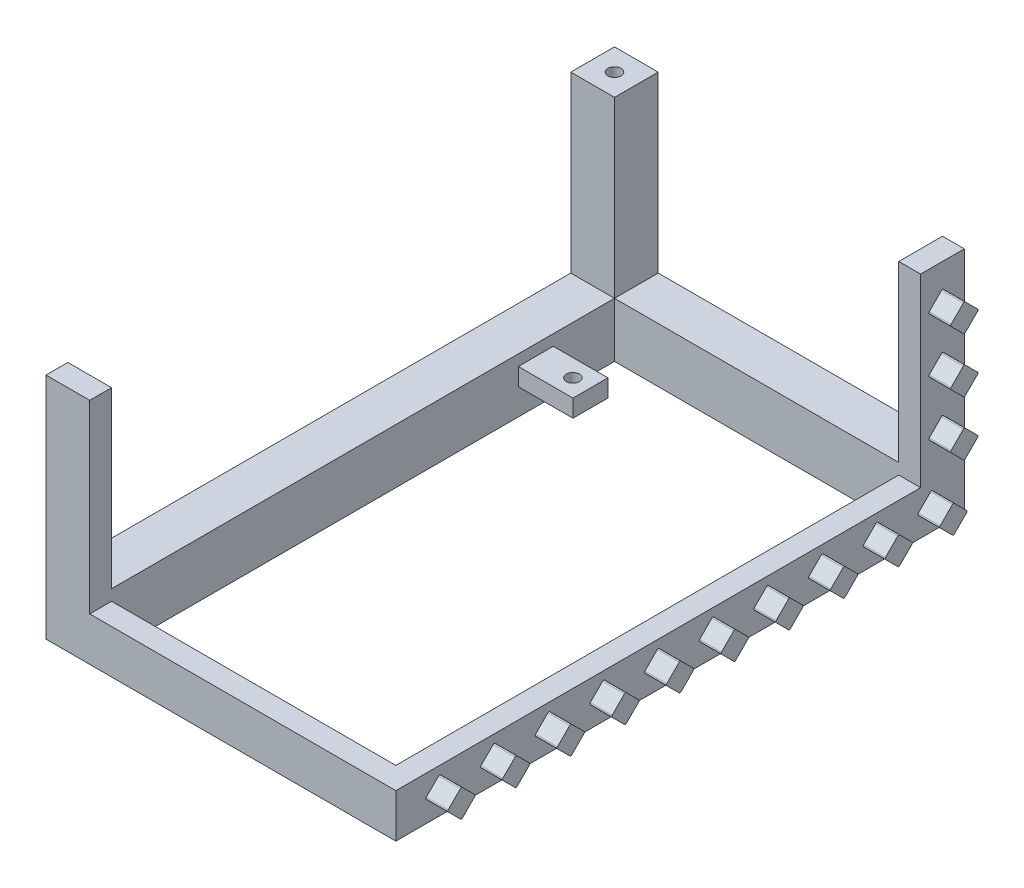
from build123d import *

# Parameters (mm, degrees)
SKETCH1_W            = 80
SKETCH1_H            = 130
BOSS_EXTRUDE1_DEPTH  = 10
BOSS_EXTRUDE10_DEPTH = 42.3
SKETCH13_W           = 115
SKETCH13_H           = 39.8
CUT_EXTRUDE3_DEPTH   = 112.961109319
SKETCH14_W           = 65
SKETCH14_H           = 39.8
CUT_EXTRUDE4_DEPTH   = 139.420699319
SKETCH15_R           = 1.5
CUT_EXTRUDE5_DEPTH   = 4
SKETCH21_R           = 1.5
CUT_EXTRUDE8_DEPTH   = 94.350361542
BOSS_EXTRUDE11_DEPTH = 5
CUT_EXTRUDE9_DEPTH   = 94.350361542
CUT_EXTRUDE10_START  = -4
SKETCH24_R           = 1.5
CUT_EXTRUDE10_DEPTH  = 4
SKETCH25_W           = 12.5
SKETCH25_H           = 8
CUT_EXTRUDE11_DEPTH  = 6


with BuildPart() as part:
    # Sketch1 → Boss-Extrude1 (new body)
    with BuildSketch(Plane(origin=(0, 0, 0), x_dir=(1, 0, 0), z_dir=(0, 1, 0))):
        with Locations((-5, 5)):
            Rectangle(SKETCH1_W, SKETCH1_H)
    extrude(amount=BOSS_EXTRUDE1_DEPTH)

    # Sketch9 → Boss-Extrude10 (add)
    with BuildSketch(Plane(origin=(0, 10, 0), x_dir=(1, 0, 0), z_dir=(0, 1, 0))):
        Polygon((35, 70), (-45, 70), (-45, -60), (-35, -60), (-35, 60), (35, 60), align=None)
    extrude(amount=BOSS_EXTRUDE10_DEPTH)

    # Sketch13 → Cut-Extrude3 (cut, through all)
    with BuildSketch(Plane(origin=(-35, 0, 0), x_dir=(0, 0, -1), z_dir=(1, 0, 0))):
        with Locations((2.5, 32.4)):
            Rectangle(SKETCH13_W, SKETCH13_H)
    extrude(amount=-CUT_EXTRUDE3_DEPTH, mode=Mode.SUBTRACT)

    # Sketch14 → Cut-Extrude4 (cut, through all)
    with BuildSketch(Plane.XY.offset(-60)):
        with Locations((-2.5, 32.4)):
            Rectangle(SKETCH14_W, SKETCH14_H)
    extrude(amount=-CUT_EXTRUDE4_DEPTH, mode=Mode.SUBTRACT)

    # Sketch15 → Cut-Extrude5 (cut)
    with BuildSketch(Plane(origin=(0, 52.3, 0), x_dir=(1, 0, 0), z_dir=(0, 1, 0))):
        with Locations((-40, 65)):
            Circle(SKETCH15_R)
    extrude(amount=-CUT_EXTRUDE5_DEPTH, mode=Mode.SUBTRACT)

    # Sketch21 → Cut-Extrude8 (cut, through all)
    with BuildSketch(Plane(origin=(0, 10, 0), x_dir=(1, 0, 0), z_dir=(0, 1, 0))):
        with Locations((-26.5, 42)):
            Circle(SKETCH21_R)
    extrude(amount=-CUT_EXTRUDE8_DEPTH, mode=Mode.SUBTRACT)

    # Sketch22 → Boss-Extrude11 (add)
    with BuildSketch(Plane(origin=(35, 0, 0), x_dir=(0, 0, -1), z_dir=(1, 0, 0))):
        with BuildLine():
            Line((-0.212132034, 8.037867966), (-3.037867966, 5.212132034))
            ThreePointArc((-3.037867966, 5.212132034), (-3.125735931, 5), (-3.037867966, 4.787867966))
            Line((-3.037867966, 4.787867966), (-0.212132034, 1.962132034))
            ThreePointArc((-0.212132034, 1.962132034), (0, 1.874264069), (0.212132034, 1.962132034))
            Line((0.212132034, 1.962132034), (3.037867966, 4.787867966))
            ThreePointArc((3.037867966, 4.787867966), (3.125735931, 5), (3.037867966, 5.212132034))
            Line((3.037867966, 5.212132034), (0.212132034, 8.037867966))
            ThreePointArc((0.212132034, 8.037867966), (0, 8.125735931), (-0.212132034, 8.037867966))
        make_face()
        with BuildLine():
            Line((15.537867966, 5.212132034), (12.712132034, 8.037867966))
            ThreePointArc((12.712132034, 8.037867966), (12.5, 8.125735931), (12.287867966, 8.037867966))
            Line((12.287867966, 8.037867966), (9.462132034, 5.212132034))
            ThreePointArc((9.462132034, 5.212132034), (9.374264069, 5), (9.462132034, 4.787867966))
            Line((9.462132034, 4.787867966), (12.287867966, 1.962132034))
            ThreePointArc((12.287867966, 1.962132034), (12.5, 1.874264069), (12.712132034, 1.962132034))
            Line((12.712132034, 1.962132034), (15.537867966, 4.787867966))
            ThreePointArc((15.537867966, 4.787867966), (15.625735931, 5), (15.537867966, 5.212132034))
        make_face()
        with BuildLine():
            Line((28.037867966, 5.212132034), (25.212132034, 8.037867966))
            ThreePointArc((25.212132034, 8.037867966), (25, 8.125735931), (24.787867966, 8.037867966))
            Line((24.787867966, 8.037867966), (21.962132034, 5.212132034))
            ThreePointArc((21.962132034, 5.212132034), (21.874264069, 5), (21.962132034, 4.787867966))
            Line((21.962132034, 4.787867966), (24.787867966, 1.962132034))
            ThreePointArc((24.787867966, 1.962132034), (25, 1.874264069), (25.212132034, 1.962132034))
            Line((25.212132034, 1.962132034), (28.037867966, 4.787867966))
            ThreePointArc((28.037867966, 4.787867966), (28.125735931, 5), (28.037867966, 5.212132034))
        make_face()
        with BuildLine():
            Line((40.537867966, 5.212132034), (37.712132034, 8.037867966))
            ThreePointArc((37.712132034, 8.037867966), (37.5, 8.125735931), (37.287867966, 8.037867966))
            Line((37.287867966, 8.037867966), (34.462132034, 5.212132034))
            ThreePointArc((34.462132034, 5.212132034), (34.374264069, 5), (34.462132034, 4.787867966))
            Line((34.462132034, 4.787867966), (37.287867966, 1.962132034))
            ThreePointArc((37.287867966, 1.962132034), (37.5, 1.874264069), (37.712132034, 1.962132034))
            Line((37.712132034, 1.962132034), (40.537867966, 4.787867966))
            ThreePointArc((40.537867966, 4.787867966), (40.625735931, 5), (40.537867966, 5.212132034))
        make_face()
        with BuildLine():
            Line((53.037867966, 5.212132034), (50.212132034, 8.037867966))
            ThreePointArc((50.212132034, 8.037867966), (50, 8.125735931), (49.787867966, 8.037867966))
            Line((49.787867966, 8.037867966), (46.962132034, 5.212132034))
            ThreePointArc((46.962132034, 5.212132034), (46.874264069, 5), (46.962132034, 4.787867966))
            Line((46.962132034, 4.787867966), (49.787867966, 1.962132034))
            ThreePointArc((49.787867966, 1.962132034), (50, 1.874264069), (50.212132034, 1.962132034))
            Line((50.212132034, 1.962132034), (53.037867966, 4.787867966))
            ThreePointArc((53.037867966, 4.787867966), (53.125735931, 5), (53.037867966, 5.212132034))
        make_face()
        with BuildLine():
            Line((65.537867966, 5.212132034), (62.712132034, 8.037867966))
            ThreePointArc((62.712132034, 8.037867966), (62.5, 8.125735931), (62.287867966, 8.037867966))
            Line((62.287867966, 8.037867966), (59.462132034, 5.212132034))
            ThreePointArc((59.462132034, 5.212132034), (59.374264069, 5), (59.462132034, 4.787867966))
            Line((59.462132034, 4.787867966), (62.287867966, 1.962132034))
            ThreePointArc((62.287867966, 1.962132034), (62.5, 1.874264069), (62.712132034, 1.962132034))
            Line((62.712132034, 1.962132034), (65.537867966, 4.787867966))
            ThreePointArc((65.537867966, 4.787867966), (65.625735931, 5), (65.537867966, 5.212132034))
        make_face()
        with BuildLine():
            Line((-9.462132034, 5.212132034), (-12.287867966, 8.037867966))
            ThreePointArc((-12.287867966, 8.037867966), (-12.5, 8.125735931), (-12.712132034, 8.037867966))
            Line((-12.712132034, 8.037867966), (-15.537867966, 5.212132034))
            ThreePointArc((-15.537867966, 5.212132034), (-15.625735931, 5), (-15.537867966, 4.787867966))
            Line((-15.537867966, 4.787867966), (-12.712132034, 1.962132034))
            ThreePointArc((-12.712132034, 1.962132034), (-12.5, 1.874264069), (-12.287867966, 1.962132034))
            Line((-12.287867966, 1.962132034), (-9.462132034, 4.787867966))
            ThreePointArc((-9.462132034, 4.787867966), (-9.374264069, 5), (-9.462132034, 5.212132034))
        make_face()
        with BuildLine():
            Line((-21.962132034, 5.212132034), (-24.787867966, 8.037867966))
            ThreePointArc((-24.787867966, 8.037867966), (-25, 8.125735931), (-25.212132034, 8.037867966))
            Line((-25.212132034, 8.037867966), (-28.037867966, 5.212132034))
            ThreePointArc((-28.037867966, 5.212132034), (-28.125735931, 5), (-28.037867966, 4.787867966))
            Line((-28.037867966, 4.787867966), (-25.212132034, 1.962132034))
            ThreePointArc((-25.212132034, 1.962132034), (-25, 1.874264069), (-24.787867966, 1.962132034))
            Line((-24.787867966, 1.962132034), (-21.962132034, 4.787867966))
            ThreePointArc((-21.962132034, 4.787867966), (-21.874264069, 5), (-21.962132034, 5.212132034))
        make_face()
        with BuildLine():
            Line((-34.462132034, 5.212132034), (-37.287867966, 8.037867966))
            ThreePointArc((-37.287867966, 8.037867966), (-37.5, 8.125735931), (-37.712132034, 8.037867966))
            Line((-37.712132034, 8.037867966), (-40.537867966, 5.212132034))
            ThreePointArc((-40.537867966, 5.212132034), (-40.625735931, 5), (-40.537867966, 4.787867966))
            Line((-40.537867966, 4.787867966), (-37.712132034, 1.962132034))
            ThreePointArc((-37.712132034, 1.962132034), (-37.5, 1.874264069), (-37.287867966, 1.962132034))
            Line((-37.287867966, 1.962132034), (-34.462132034, 4.787867966))
            ThreePointArc((-34.462132034, 4.787867966), (-34.374264069, 5), (-34.462132034, 5.212132034))
        make_face()
        with BuildLine():
            Line((-46.962132034, 5.212132034), (-49.787867966, 8.037867966))
            ThreePointArc((-49.787867966, 8.037867966), (-50, 8.125735931), (-50.212132034, 8.037867966))
            Line((-50.212132034, 8.037867966), (-53.037867966, 5.212132034))
            ThreePointArc((-53.037867966, 5.212132034), (-53.125735931, 5), (-53.037867966, 4.787867966))
            Line((-53.037867966, 4.787867966), (-50.212132034, 1.962132034))
            ThreePointArc((-50.212132034, 1.962132034), (-50, 1.874264069), (-49.787867966, 1.962132034))
            Line((-49.787867966, 1.962132034), (-46.962132034, 4.787867966))
            ThreePointArc((-46.962132034, 4.787867966), (-46.874264069, 5), (-46.962132034, 5.212132034))
        make_face()
        with BuildLine():
            Line((61.962132034, 31.362132034), (64.787867966, 34.187867966))
            ThreePointArc((64.787867966, 34.187867966), (65, 34.275735931), (65.212132034, 34.187867966))
            Line((65.212132034, 34.187867966), (68.037867966, 31.362132034))
            ThreePointArc((68.037867966, 31.362132034), (68.125735931, 31.15), (68.037867966, 30.937867966))
            Line((68.037867966, 30.937867966), (65.212132034, 28.112132034))
            ThreePointArc((65.212132034, 28.112132034), (65, 28.024264069), (64.787867966, 28.112132034))
            Line((64.787867966, 28.112132034), (61.962132034, 30.937867966))
            ThreePointArc((61.962132034, 30.937867966), (61.874264069, 31.15), (61.962132034, 31.362132034))
        make_face()
        with BuildLine():
            Line((64.787867966, 40.612132034), (61.962132034, 43.437867966))
            ThreePointArc((61.962132034, 43.437867966), (61.874264069, 43.65), (61.962132034, 43.862132034))
            Line((61.962132034, 43.862132034), (64.787867966, 46.687867966))
            ThreePointArc((64.787867966, 46.687867966), (65, 46.775735931), (65.212132034, 46.687867966))
            Line((65.212132034, 46.687867966), (68.037867966, 43.862132034))
            ThreePointArc((68.037867966, 43.862132034), (68.125735931, 43.65), (68.037867966, 43.437867966))
            Line((68.037867966, 43.437867966), (65.212132034, 40.612132034))
            ThreePointArc((65.212132034, 40.612132034), (65, 40.524264069), (64.787867966, 40.612132034))
        make_face()
        with BuildLine():
            Line((64.787867966, 15.612132034), (61.962132034, 18.437867966))
            ThreePointArc((61.962132034, 18.437867966), (61.874264069, 18.65), (61.962132034, 18.862132034))
            Line((61.962132034, 18.862132034), (64.787867966, 21.687867966))
            ThreePointArc((64.787867966, 21.687867966), (65, 21.775735931), (65.212132034, 21.687867966))
            Line((65.212132034, 21.687867966), (68.037867966, 18.862132034))
            ThreePointArc((68.037867966, 18.862132034), (68.125735931, 18.65), (68.037867966, 18.437867966))
            Line((68.037867966, 18.437867966), (65.212132034, 15.612132034))
            ThreePointArc((65.212132034, 15.612132034), (65, 15.524264069), (64.787867966, 15.612132034))
        make_face()
    extrude(amount=BOSS_EXTRUDE11_DEPTH)

    # Sketch23 → Cut-Extrude9 (cut, through all)
    with BuildSketch(Plane(origin=(0, 10, 0), x_dir=(1, 0, 0), z_dir=(0, 1, 0))):
        Polygon((30, -55), (-35, -55), (-35, 38), (-22.5, 38), (-22.5, 46), (-35, 46), (-35, 60), (30, 60), align=None)
    extrude(amount=-CUT_EXTRUDE9_DEPTH, mode=Mode.SUBTRACT)

    # Sketch24 → Cut-Extrude10 (cut)
    with BuildSketch(Plane.XZ.offset(CUT_EXTRUDE10_START)):
        with Locations((-40, -65)):
            Circle(SKETCH24_R)
    extrude(amount=CUT_EXTRUDE10_DEPTH, mode=Mode.SUBTRACT)

    # Sketch25 → Cut-Extrude11 (cut)
    with BuildSketch(Plane.XZ):
        with Locations((-28.75, -42)):
            Rectangle(SKETCH25_W, SKETCH25_H)
    extrude(amount=-CUT_EXTRUDE11_DEPTH, mode=Mode.SUBTRACT)


solid = part.part
